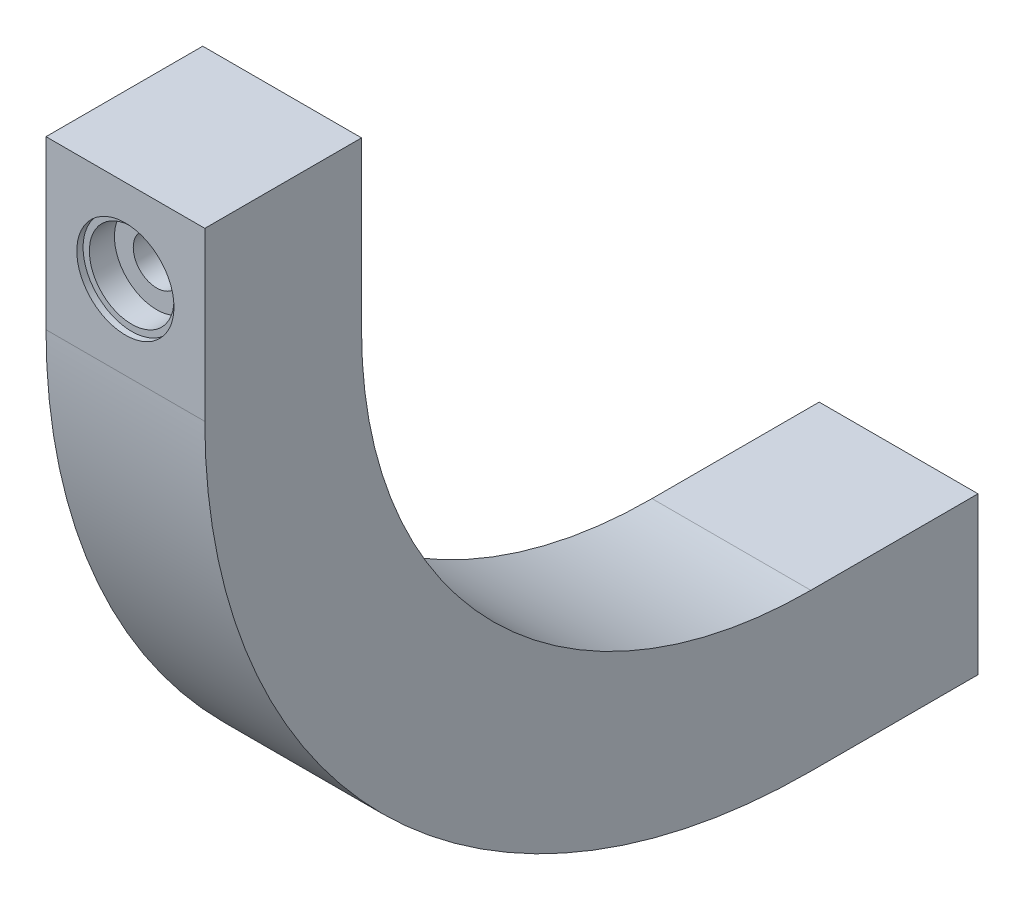
from build123d import *

# Parameters (mm, degrees)
BOSS_EXTRUDE1_DEPTH      = 7.6
BOSS_EXTRUDE1_DEPTH_BACK = 7.6
SKETCH7_R                = 2.25
CUT_EXTRUDE1_DEPTH       = 94.646996748
SKETCH15_R               = 2.05
CUT_EXTRUDE11_DEPTH      = 10


with BuildPart() as part:
    # Sketch5 → Boss-Extrude1 (new, two sides: drawn at the far end of the back side and taken through both)
    with BuildSketch(Plane(origin=(0, 0, 0), x_dir=(0, 0, -1), z_dir=(1, 0, 0)).offset(-BOSS_EXTRUDE1_DEPTH_BACK)):
        with BuildLine():
            Line((-51, 8), (-51, 0))
            Line((-51, 0), (-51, -8))
            ThreePointArc((-51, -8), (-38.405591591, -38.405591591), (-8, -51))
            Line((-8, -51), (0, -51))
            Line((0, -51), (8, -51))
            Line((8, -51), (8, -66))
            Line((8, -66), (-8, -66))
            ThreePointArc((-8, -66), (-49.012193309, -49.012193309), (-66, -8))
            Line((-66, -8), (-66, 8))
            Line((-66, 8), (-51, 8))
        make_face()
    extrude(amount=BOSS_EXTRUDE1_DEPTH + BOSS_EXTRUDE1_DEPTH_BACK)

    # Sketch7 → Cut-Extrude1 (cut, through all)
    with BuildSketch(Plane.XY):
        Circle(SKETCH7_R)
    extrude(amount=CUT_EXTRUDE1_DEPTH, mode=Mode.SUBTRACT)

    # Sketch15 → Cut-Extrude11 (cut)
    with BuildSketch(Plane.XZ.offset(66)):
        Circle(SKETCH15_R)
    extrude(amount=-CUT_EXTRUDE11_DEPTH, mode=Mode.SUBTRACT)

    # Sketch18 → Cut-Revolve1 (revolve, cut)
    with BuildSketch(Plane(origin=(0, 0, 0), x_dir=(0, 0, -1), z_dir=(1, 0, 0))):
        Polygon((-66, 4.65), (-66, 0), (-63, 0), (-63, 4.05), (-65.4, 4.05), (-65.4, 4.65), align=None)
        Polygon((-51.6, 4.65), (-51, 4.65), (-51, 0), (-54, 0), (-54, 4.05), (-51.6, 4.05), align=None)
    revolve(axis=Axis((0, 0, 109.558527697), (0, 0, -1)), mode=Mode.SUBTRACT)


solid = part.part
